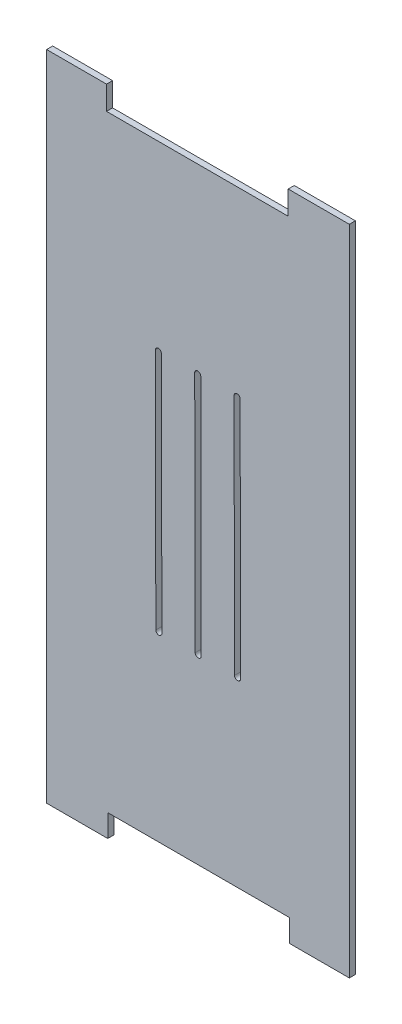
from build123d import *

# Parameters (mm, degrees)
SKETCH1_W           = 540
SKETCH1_H           = 540
BOSS_EXTRUDE1_DEPTH = 5
CHAMFER2_SIZE       = 0.5
CHAMFER3_SIZE       = 2
SKETCH3_W           = 150
SKETCH3_H           = 20
CUT_EXTRUDE2_DEPTH  = 10
CIRPATTERN1_COUNT   = 4
CUT_EXTRUDE3_DEPTH  = 10
LPATTERN1_COUNT     = 2
LPATTERN1_PITCH     = 32.5
LPATTERN2_COUNT     = 2
LPATTERN2_PITCH     = 32.5
SKETCH7_W           = 697.267045649
SKETCH7_H           = 709.774077858
SKETCH7_W_2         = 250
SKETCH7_H_2         = 539
CUT_EXTRUDE4_DEPTH  = 764.691691719


with BuildPart() as part:
    # Sketch1 → Boss-Extrude1 (new body)
    with BuildSketch(Plane.XY):
        with Locations((270, 270)):
            Rectangle(SKETCH1_W, SKETCH1_H)
    extrude(amount=BOSS_EXTRUDE1_DEPTH)

    # Chamfer2
    chamfer2_edges = [part.edges().sort_by_distance(p)[0] for p in [
        (540, 270, 5),
        (270, 540, 5),
        (0, 270, 5),
        (270, 540, 0),
        (540, 270, 0),
        (270, 0, 0),
        (0, 270, 0),
        (270, 0, 5),
    ]]
    chamfer(chamfer2_edges, length=CHAMFER2_SIZE)

    # Chamfer3
    # the kernel refuses this chamfer: 2 mm, written as the material it takes off along each edge
    with BuildSketch(Plane(origin=(0, 540, -4.643365976), x_dir=(-0.027495876610586483, -0.9996219169112968, 0), z_dir=(0, 0, 1)), Plane(origin=(0, 0, -4.643365976), x_dir=(0.9996219169112968, -0.027495876610586372, 0), z_dir=(0, 0, 1))) as chamfer3_piece_1:
        Polygon((CHAMFER3_SIZE * 0.999621916911, CHAMFER3_SIZE * 0.0274958766106), (-CHAMFER3_SIZE * 0.0274958766106, CHAMFER3_SIZE * 0.999621916911), (0, 0), align=None)
    extrude(amount=14.286731952, mode=Mode.SUBTRACT)
    with BuildSketch(Plane(origin=(540, 540, -4.643365976), x_dir=(0.02749587661058229, -0.9996219169112968, 0), z_dir=(0, 0, 1)), Plane(origin=(540, 0, -4.643365976), x_dir=(-0.9996219169112968, -0.027495876610586483, 0), z_dir=(0, 0, 1))) as chamfer3_piece_2:
        Polygon((CHAMFER3_SIZE * 0.999621916911, -CHAMFER3_SIZE * 0.0274958766106), (-CHAMFER3_SIZE * 0.0274958766106, -CHAMFER3_SIZE * 0.999621916911), (0, 0), align=None)
    extrude(amount=14.286731952, mode=Mode.SUBTRACT)

    # Sketch3 → Cut-Extrude2 (cut)
    with BuildSketch(Plane.XY.offset(5)):
        with Locations((270, 530)):
            Rectangle(SKETCH3_W, SKETCH3_H)
    cut_extrude2 = extrude(amount=-CUT_EXTRUDE2_DEPTH, mode=Mode.SUBTRACT)

    # CirPattern1: Cut-Extrude2 ×4 about axis
    cirpattern1_axis = Axis((270.5, 269.5, 0), (0, 0, 1))
    for i in range(1, CIRPATTERN1_COUNT):
        add(cut_extrude2.rotate(cirpattern1_axis, i * 360 / CIRPATTERN1_COUNT), mode=Mode.SUBTRACT)

    # Sketch6 → Cut-Extrude3 (cut)
    with BuildSketch(Plane.XY.offset(5)):
        with BuildLine():
            Line((272.800394222, 369.50499001), (273.199595818, 169.50499001))
            ThreePointArc((273.199595818, 169.50499001), (270.704590808, 167.00000498), (268.199605778, 169.49500999))
            Line((268.199605778, 169.49500999), (267.800404182, 369.49500999))
            ThreePointArc((267.800404182, 369.49500999), (270.295409192, 371.99999502), (272.800394222, 369.50499001))
        make_face()
    cut_extrude3 = extrude(amount=-CUT_EXTRUDE3_DEPTH, mode=Mode.SUBTRACT)

    # LPattern1: Cut-Extrude3 ×2
    with Locations(*[(i * LPATTERN1_PITCH, 0, 0) for i in range(1, LPATTERN1_COUNT)]):
        add(cut_extrude3, mode=Mode.SUBTRACT)

    # LPattern2: Cut-Extrude3 ×2
    with Locations(*[(-i * LPATTERN2_PITCH, 0, 0) for i in range(1, LPATTERN2_COUNT)]):
        add(cut_extrude3, mode=Mode.SUBTRACT)

    # Sketch7 → Cut-Extrude4 (cut, through all)
    with BuildSketch(Plane.XY.offset(5)):
        with Locations((264.820460551, 266.911861518)):
            Rectangle(SKETCH7_W, SKETCH7_H)
        with Locations((270.5, 270)):
            Rectangle(SKETCH7_W_2, SKETCH7_H_2, mode=Mode.SUBTRACT)
    extrude(amount=-CUT_EXTRUDE4_DEPTH, mode=Mode.SUBTRACT)


solid = part.part
